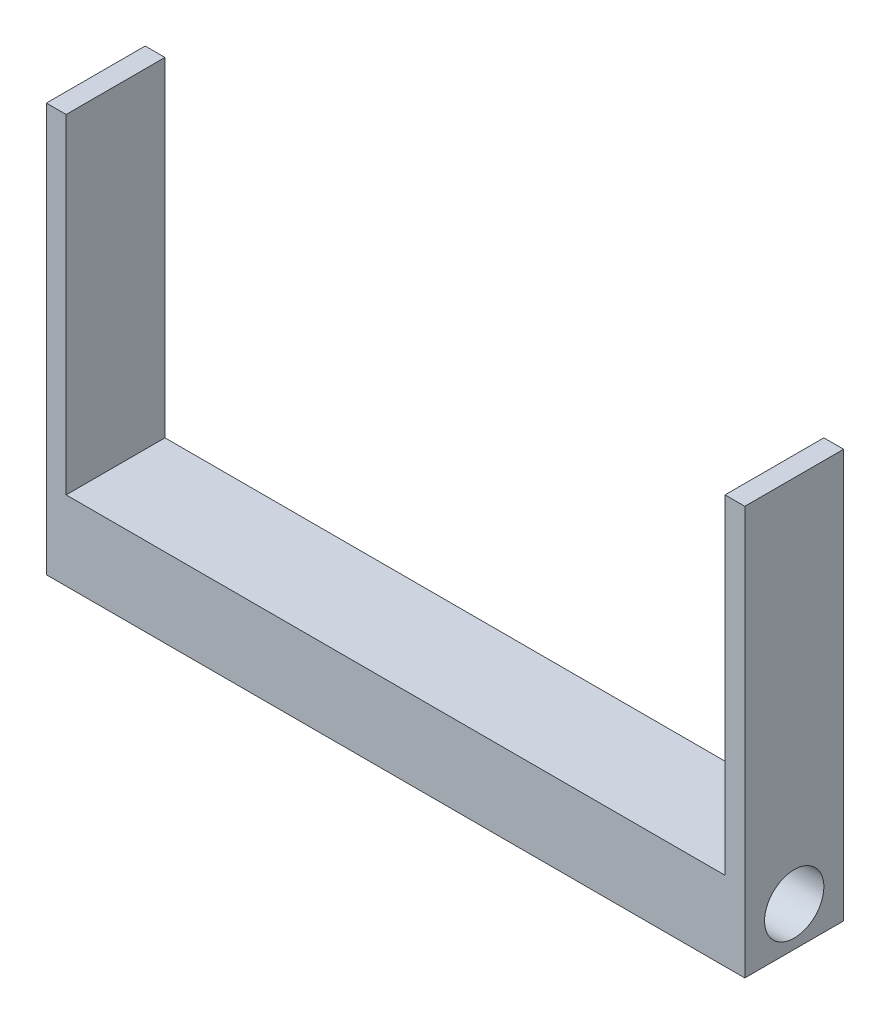
from build123d import *

# Parameters (mm, degrees)
EXTRUDE_THIN1_DEPTH = 7.5
SKETCH4_W           = 106
SKETCH4_H           = 15
BOSS_EXTRUDE1_DEPTH = 9
SKETCH5_R           = 4.5
CUT_EXTRUDE1_DEPTH  = 124.029468015


with BuildPart() as part:
    # Sketch1 → Extrude-Thin1 (new, symmetric)
    with BuildSketch(Plane.XY):
        Polygon((-50, 0), (-50, -50), (50, -50), (50, 0), (53, 0), (53, -53), (-53, -53), (-53, 0), align=None)
    extrude(amount=EXTRUDE_THIN1_DEPTH, both=True)

    # Sketch4 → Boss-Extrude1 (add)
    with BuildSketch(Plane.XZ.offset(53)):
        Rectangle(SKETCH4_W, SKETCH4_H)
    extrude(amount=BOSS_EXTRUDE1_DEPTH)

    # Sketch5 → Cut-Extrude1 (cut, through all)
    with BuildSketch(Plane(origin=(53, 0, 0), x_dir=(0, 0, -1), z_dir=(1, 0, 0))):
        with Locations((0, -56)):
            Circle(SKETCH5_R)
    extrude(amount=-CUT_EXTRUDE1_DEPTH, mode=Mode.SUBTRACT)


solid = part.part
